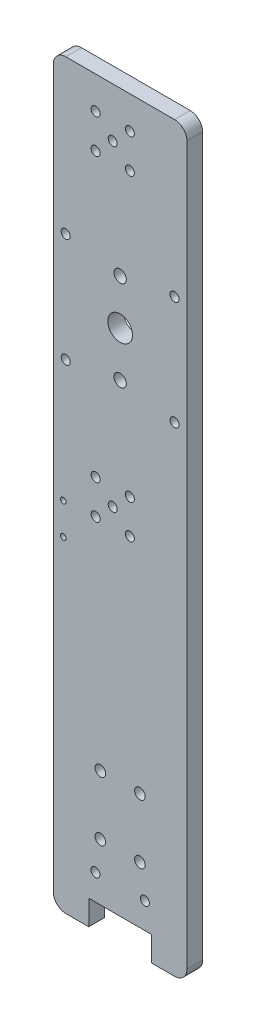
from build123d import *

# Parameters (mm, degrees)
SKETCH1_W                     = 54
SKETCH1_H                     = 300
BOSS_EXTRUDE1_DEPTH           = 6.35
FILLET1_R                     = 5
SKETCH3_R                     = 5
CUT_EXTRUDE1_DEPTH            = 153.542854634
F_6_CLEARANCE_HOLE1_D         = 3.6576
CUT_EXTRUDE2_DEPTH            = 153.542854634
F_10_CLEARANCE_HOLE2_D        = 4.9784
F_6_CLEARANCE_HOLE2_D         = 3.6576
F_8_CLEARANCE_HOLE1_D         = 4.3053
TAP_DRILL_FOR_4_40_TAP1_D     = 2.2606
TAP_DRILL_FOR_4_40_TAP1_DEPTH = 6.35
TAP_DRILL_FOR_4_40_TAP1_TIP   = 0.679152758


with BuildPart() as part:
    # Sketch1 → Boss-Extrude1 (new body)
    with BuildSketch(Plane.XY):
        Rectangle(SKETCH1_W, SKETCH1_H)
    extrude(amount=BOSS_EXTRUDE1_DEPTH)

    # Fillet1
    fillet1_edges = [part.edges().sort_by_distance(p)[0] for p in [
        (27, -150, 3.175),
        (-27, -150, 3.175),
        (27, 150, 3.175),
        (-27, 150, 3.175),
    ]]
    fillet(fillet1_edges, radius=FILLET1_R)

    # Sketch3 → Cut-Extrude1 (cut, through all)
    with BuildSketch(Plane.XY.offset(6.35)):
        with Locations((0, 65.974)):
            Circle(SKETCH3_R)
    extrude(amount=-CUT_EXTRUDE1_DEPTH, mode=Mode.SUBTRACT)

    # #6 Clearance Hole1 (through all)
    with Locations(Plane.XY.offset(6.35)):
        with Locations((-22, 87.974), (-22, 43.974), (22, 43.974), (22, 87.974), (-9.914797213, 123.085202787), (-9.914797213, 136.914797213), (3.914797213, 136.914797213), (3.914797213, 123.085202787), (-9.914797213, 8.862797213), (3.914797213, 8.862797213), (3.914797213, -4.966797213), (-9.914797213, -4.966797213), (-3, 130), (-3, 1.948)):
            Hole(F_6_CLEARANCE_HOLE1_D / 2)

    # Sketch6 → Cut-Extrude2 (cut, through all)
    with BuildSketch(Plane.XY.offset(6.35)):
        Polygon((-12.7, -150), (-12.6, -140), (12.6, -140), (12.7, -150), align=None)
    extrude(amount=-CUT_EXTRUDE2_DEPTH, mode=Mode.SUBTRACT)

    # #10 Clearance Hole2 (through all)
    with Locations(Plane.XY.offset(6.35)):
        with Locations((0, 47.724), (0, 84.224)):
            Hole(F_10_CLEARANCE_HOLE2_D / 2)

    # #6 Clearance Hole2 (through all)
    with Locations(Plane(origin=(-10, -129.5352, 6.35), x_dir=(1, 0, 0), z_dir=(0, 0, 1))):
        with Locations((0, 0), (20, 0)):
            Hole(F_6_CLEARANCE_HOLE2_D / 2)

    # #8 Clearance Hole1 (through all)
    with Locations(Plane(origin=(-8, -93, 6.35), x_dir=(1, 0, 0), z_dir=(0, 0, 1))):
        with Locations((0, 0), (16, 0), (16, -24), (0, -24)):
            Hole(F_8_CLEARANCE_HOLE1_D / 2)

    # Tap Drill for #4-40 Tap1
    with Locations(Plane(origin=(-23, -18.626, 6.35), x_dir=(1, 0, 0), z_dir=(0, 0, 1))):
        with Locations((0, 0), (0, 12.7)):
            Hole(TAP_DRILL_FOR_4_40_TAP1_D / 2, depth=TAP_DRILL_FOR_4_40_TAP1_DEPTH)
            with Locations((0, 0, -(TAP_DRILL_FOR_4_40_TAP1_DEPTH + TAP_DRILL_FOR_4_40_TAP1_TIP / 2))):  # 118° drill point
                Cone(0, TAP_DRILL_FOR_4_40_TAP1_D / 2, TAP_DRILL_FOR_4_40_TAP1_TIP, mode=Mode.SUBTRACT)


solid = part.part
